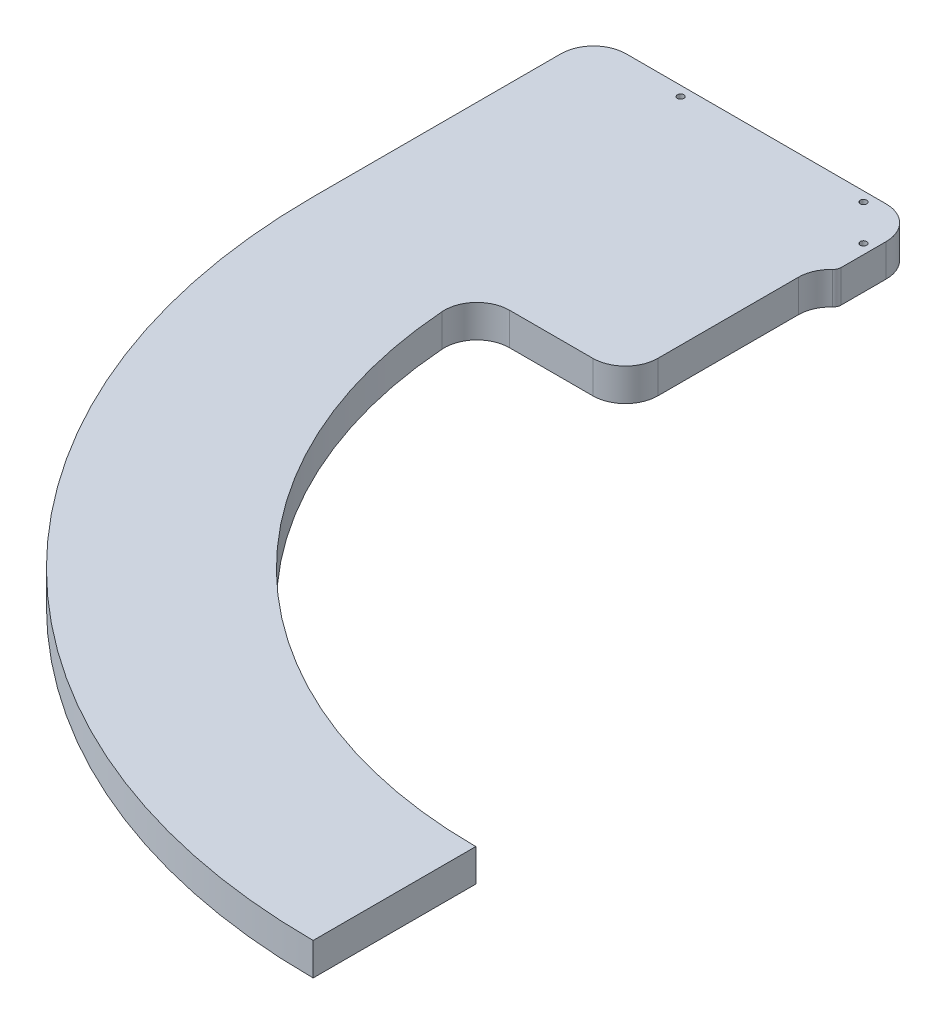
from build123d import *

# Parameters (mm, degrees)
BOSS_EXTRUDE1_DEPTH   = 10
F_2_0MM_DOWEL_HOLE1_D = 2
FILLET1_R             = 10
FILLET2_R             = 2.5


with BuildPart() as part:
    # Sketch1 → Boss-Extrude1 (new body)
    with BuildSketch(Plane(origin=(0, 0, 0), x_dir=(1, 0, 0), z_dir=(0, 1, 0))):
        with BuildLine():
            Line((146.108539292, 1980.364966037), (146.108539292, 1898.164966235))
            ThreePointArc((146.108539292, 1898.164966235), (204.100938953, 1758.158928457), (344.106976731, 1700.166528796))
            Line((344.106976731, 1700.166528796), (344.106976731, 1750.166528796))
            ThreePointArc((344.106976731, 1750.166528796), (239.456278012, 1793.514267516), (196.108539292, 1898.164966235))
            Line((196.108539292, 1898.164966235), (242.106976731, 1898.164966235))
            Line((242.106976731, 1898.164966235), (242.106976731, 1959.364966037))
            Line((242.106976731, 1959.364966037), (246.106976731, 1959.364966037))
            Line((246.106976731, 1959.364966037), (246.106976731, 1984.364966037))
            Line((246.106976731, 1984.364966037), (146.108539292, 1984.364966037))
            Line((146.108539292, 1984.364966037), (146.108539292, 1980.364966037))
        make_face()
    extrude(amount=-BOSS_EXTRUDE1_DEPTH)

    # Ø2.0mm Dowel Hole1 (through all)
    with Locations(Plane(origin=(0, 0, 0), x_dir=(1, 0, 0), z_dir=(0, 1, 0))):
        with Locations((175.906976731, 1981.364966037), (232.106976731, 1981.364966037), (243.106976731, 1970.364966037)):
            Hole(F_2_0MM_DOWEL_HOLE1_D / 2)

    # Fillet1
    # the kernel refuses this fillet: 10 mm, written as the material it adds along each edge
    with BuildSketch(Plane(origin=(196.108539292, 0, -1898.164966235), x_dir=(0.03625613161983894, 0, 0.9993425303267969), z_dir=(0, -1, 0))) as fillet1_piece_1:
        with BuildLine():
            CenterArc((10.369140338, -9.993425303), FILLET1_R, 87.922221298, 94.155557404)
            Line((0.375715035, -10.355986619), (0, 0))
            ThreePointArc((0, 0), (5.365850827, 0.097304484), (10.731701655, 0))
        make_face()
    extrude(amount=10)
    with BuildSketch(Plane(origin=(242.106976731, 0, -1959.364966037), x_dir=(1, 0, 0), z_dir=(0, -1, 0))) as fillet1_piece_2:
        with BuildLine():
            CenterArc((10, 8), FILLET1_R, 180, 53.130102354)
            Line((0, 8), (0, 0))
            Line((0, 0), (4, 0))
        make_face()
    extrude(amount=10)
    # the kernel refuses this fillet: 10 mm, written as the material it takes off along each edge
    with BuildSketch(Plane(origin=(146.108539292, 25, -1984.364966037), x_dir=(0, 0, 1), z_dir=(0, -1, 0)), Plane(origin=(246.106976731, 25, -1984.364966037), x_dir=(-1, 0, 0), z_dir=(0, -1, 0))) as fillet1_2_piece_1:
        with BuildLine():
            CenterArc((FILLET1_R, -FILLET1_R), FILLET1_R, 90, 90)
            Line((0, -FILLET1_R), (0, 0))
            Line((0, 0), (FILLET1_R, 0))
        make_face()
    extrude(amount=60, mode=Mode.SUBTRACT)
    with BuildSketch(Plane(origin=(242.106976731, 25, -1898.164966235), x_dir=(-1, 0, 0), z_dir=(0, -1, 0))) as fillet1_2_piece_2:
        with BuildLine():
            CenterArc((FILLET1_R, FILLET1_R), FILLET1_R, 180, 90)
            Line((0, FILLET1_R), (0, 0))
            Line((0, 0), (FILLET1_R, 0))
        make_face()
    extrude(amount=60, mode=Mode.SUBTRACT)

    # Fillet2
    fillet2_edges = [part.edges().sort_by_distance(p)[0] for p in [
        (246.106976731, -5, -1959.364966037),
    ]]
    fillet(fillet2_edges, radius=FILLET2_R)


solid = part.part
